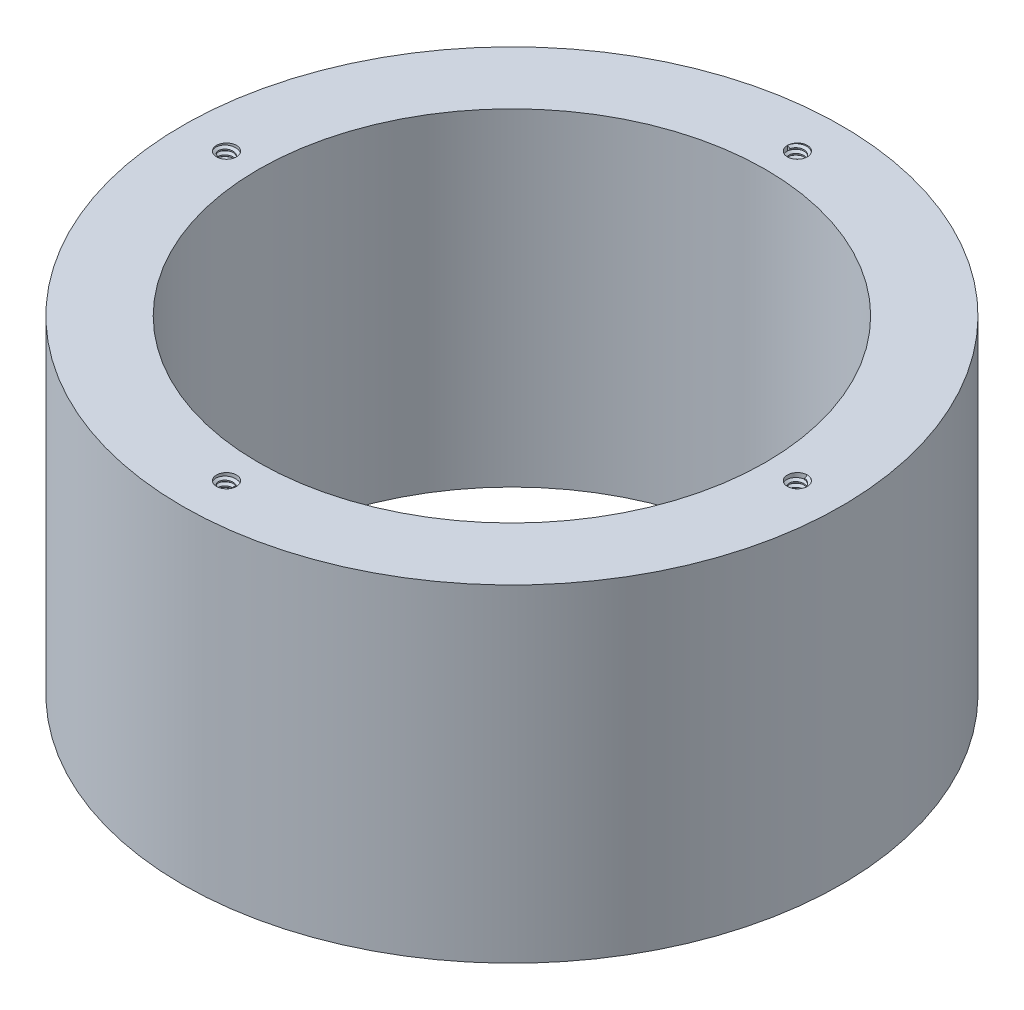
from build123d import *
from build123d.topology import SkipClean

# Parameters (mm, degrees)
SKETCH1_R           = 16.5
SKETCH1_R_2         = 12.7
BOSS_EXTRUDE1_DEPTH = 16.4
SKETCH2_R           = 0.5
CUT_EXTRUDE1_DEPTH  = 2
THREAD1_PITCH       = 0.25
CIRPATTERN1_COUNT   = 4
CUT_EXTRUDE2_START  = -2
SKETCH7_R           = 0.5
CUT_EXTRUDE2_DEPTH  = 2
THREAD2_PITCH       = 0.25
CIRPATTERN2_COUNT   = 4


with BuildPart() as part:
    # Sketch1 → Boss-Extrude1 (new body)
    with BuildSketch(Plane(origin=(0, 0, 0), x_dir=(1, 0, 0), z_dir=(0, 1, 0))):
        with Locations(Location((0, 0, 0), (0, 0, 270))):
            Circle(SKETCH1_R)
        with Locations(Location((0, 0, 0), (0, 0, 270))):
            Circle(SKETCH1_R_2, mode=Mode.SUBTRACT)
    extrude(amount=BOSS_EXTRUDE1_DEPTH)

    # Sketch2 → Cut-Extrude1 (cut)
    with BuildSketch(Plane(origin=(0, 16.4, 0), x_dir=(1, 0, 0), z_dir=(0, 1, 0))):
        with Locations(Location((0, 14.29, 0), (0, 0, 270))):
            Circle(SKETCH2_R)
    cut_extrude1 = extrude(amount=-CUT_EXTRUDE1_DEPTH, mode=Mode.SUBTRACT)

    # Thread1: the profile of Thread Profile2 profile screwed along a right-hand helix of 8 turns, 6 arcs to a turn; built about Z, then put on its axis
    with SkipClean():  # the faces are left unmerged after this step: merging them gives an invalid solid
        thread1_z = Axis((0, 0, 0), (0, 0, 1))
        thread1_corners = [(0.5003, 0, -0.000173205), (0.5003, 0, 0.218923204), (0.364683531, 0, 0.140625), (0.364683531, 0, 0.078125)]
        with BuildLine(mode=Mode.PRIVATE) as thread1_profile:
            Line(thread1_corners[0], thread1_corners[1])
            Line(thread1_corners[1], thread1_corners[2])
            Line(thread1_corners[2], thread1_corners[3])
            Line(thread1_corners[3], thread1_corners[0])
        thread1_cap = Face(thread1_profile.wire())
        thread1_turn_angles = [0, 30, 60, 90, 120, 150, 180, 210, 240, 270, 300, 330, 360]
        thread1_turn_weights = [1, 0.8660254037844387, 1, 0.8660254037844387, 1, 0.8660254037844387, 1, 0.8660254037844387, 1, 0.8660254037844387, 1, 0.8660254037844387, 1]
        thread1_turn_rails = [Edge.make_bspline([Vector(p[0], p[1], 0).rotate(thread1_z, thread1_turn_angles[k]) / thread1_turn_weights[k] + Vector(0, 0, p[2] + THREAD1_PITCH * thread1_turn_angles[k] / 360) for k in range(13)], [0, 0, 0, 1, 1, 2, 2, 3, 3, 4, 4, 5, 5, 6, 6, 6], 2, thread1_turn_weights) for p in thread1_corners]
        thread1_turn_sides = [Face.make_surface_from_curves(thread1_turn_rails[p[0]], thread1_turn_rails[p[1]]) for p in [(0, 1), (1, 2), (2, 3), (3, 0)]]
        thread1 = Plane(origin=(0, 16.4, -14.29), x_dir=(-1, 0, 0), z_dir=(0, -1, 0)) * Solid(Shell([*[p.moved(Location((0, 0, THREAD1_PITCH * i))) for i in range(8) for p in thread1_turn_sides], thread1_cap, thread1_cap.rotate(thread1_z, 2880).moved(Location((0, 0, THREAD1_PITCH * 2880 / 360)))]))
        add(thread1)

    # CirPattern1: Cut-Extrude1, Thread1 ×4 about axis
    with SkipClean():  # the faces are left unmerged after this step: merging them gives an invalid solid
        cirpattern1_axis = Axis((0, 16.4, 0), (0, 1, 0))
        add([cut_extrude1.rotate(cirpattern1_axis, i * 360 / CIRPATTERN1_COUNT) for i in range(1, CIRPATTERN1_COUNT)], mode=Mode.SUBTRACT)
        add([thread1.rotate(cirpattern1_axis, i * 360 / CIRPATTERN1_COUNT) for i in range(1, CIRPATTERN1_COUNT)])

    # Sketch7 → Cut-Extrude2 (cut)
    with SkipClean():  # the faces are left unmerged after this step: merging them gives an invalid solid
        with BuildSketch(Plane.XZ.offset(CUT_EXTRUDE2_START)):
            with Locations(Location((0, 14.29, 0), (0, 0, 270))):
                Circle(SKETCH7_R)
        cut_extrude2 = extrude(amount=CUT_EXTRUDE2_DEPTH, mode=Mode.SUBTRACT)

    # Thread2: the profile of Thread Profile3 profile screwed along a right-hand helix of 8 turns, 6 arcs to a turn; built about Z, then put on its axis
    with SkipClean():  # the faces are left unmerged after this step: merging them gives an invalid solid
        thread2_z = Axis((0, 0, 0), (0, 0, 1))
        thread2_corners = [(0.5003, 0, -0.000173205), (0.5003, 0, 0.218923204), (0.364683531, 0, 0.140625), (0.364683531, 0, 0.078125)]
        with BuildLine(mode=Mode.PRIVATE) as thread2_profile:
            Line(thread2_corners[0], thread2_corners[1])
            Line(thread2_corners[1], thread2_corners[2])
            Line(thread2_corners[2], thread2_corners[3])
            Line(thread2_corners[3], thread2_corners[0])
        thread2_cap = Face(thread2_profile.wire())
        thread2_turn_angles = [0, 30, 60, 90, 120, 150, 180, 210, 240, 270, 300, 330, 360]
        thread2_turn_weights = [1, 0.8660254037844387, 1, 0.8660254037844387, 1, 0.8660254037844387, 1, 0.8660254037844387, 1, 0.8660254037844387, 1, 0.8660254037844387, 1]
        thread2_turn_rails = [Edge.make_bspline([Vector(p[0], p[1], 0).rotate(thread2_z, thread2_turn_angles[k]) / thread2_turn_weights[k] + Vector(0, 0, p[2] + THREAD2_PITCH * thread2_turn_angles[k] / 360) for k in range(13)], [0, 0, 0, 1, 1, 2, 2, 3, 3, 4, 4, 5, 5, 6, 6, 6], 2, thread2_turn_weights) for p in thread2_corners]
        thread2_turn_sides = [Face.make_surface_from_curves(thread2_turn_rails[p[0]], thread2_turn_rails[p[1]]) for p in [(0, 1), (1, 2), (2, 3), (3, 0)]]
        thread2 = Plane(origin=(0, 0, 14.29), x_dir=(1, 0, 0), z_dir=(0, 1, 0)) * Solid(Shell([*[p.moved(Location((0, 0, THREAD2_PITCH * i))) for i in range(8) for p in thread2_turn_sides], thread2_cap, thread2_cap.rotate(thread2_z, 2880).moved(Location((0, 0, THREAD2_PITCH * 2880 / 360)))]))
        add(thread2)

    # CirPattern2: Cut-Extrude2, Thread2 ×4 about axis
    with SkipClean():  # the faces are left unmerged after this step: merging them gives an invalid solid
        cirpattern2_axis = Axis((0, 0, 0), (0, 1, 0))
        add([cut_extrude2.rotate(cirpattern2_axis, i * 360 / CIRPATTERN2_COUNT) for i in range(1, CIRPATTERN2_COUNT)], mode=Mode.SUBTRACT)
        add([thread2.rotate(cirpattern2_axis, i * 360 / CIRPATTERN2_COUNT) for i in range(1, CIRPATTERN2_COUNT)])


solid = part.part
